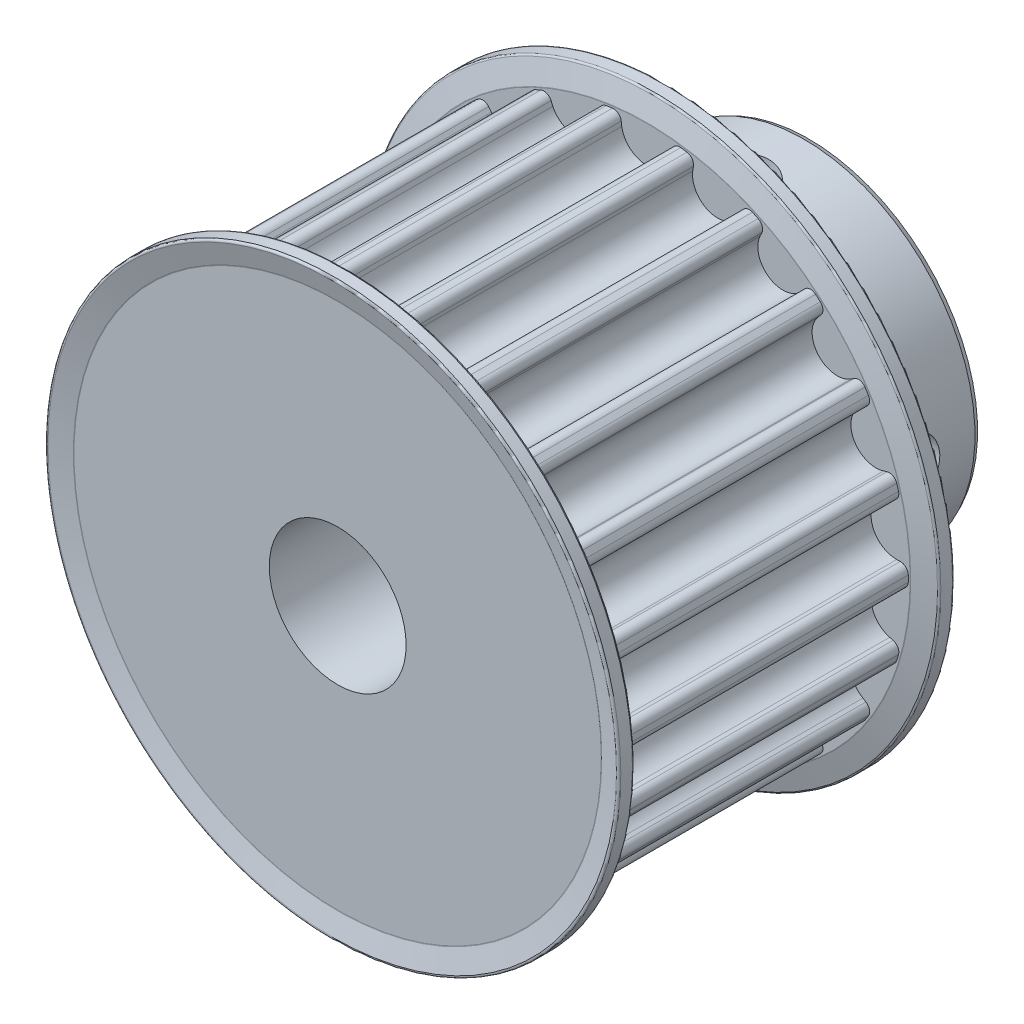
from build123d import *
from OCP.BRepFilletAPI import BRepFilletAPI_MakeChamfer

# Parameters (mm, degrees)
SKETCH4_R                  = 26.776696733
EXTRUDE1_DEPTH             = 15
EXTRUDE2_DEPTH             = 30
CIRPATTERN1_COUNT          = 22
FILLET1_R                  = 0.8
CIRPATTERN2_START          = -15
CIRPATTERN2_DEPTH          = 30
SKETCH12_R                 = 17.5
EXTRUDE4_DEPTH             = 15
F_14_0_14_DIAMETER_HOLE1_D = 14
CHAMFER1_SIZE              = 0.5
CHAMFER1_SIZE2             = 0.233153829
FILLET4_R                  = 0.2
CIRPATTERN3_COUNT          = 2
CIRPATTERN3_ANGLE          = 90


# Read off the part's stored shape, not the designer's step: CirPattern2
with BuildPart() as part:
    # Sketch4 → Extrude1 (new, symmetric)
    with BuildSketch(Plane.XY):
        Circle(SKETCH4_R)
    extrude(amount=EXTRUDE1_DEPTH, both=True)

    # Sketch5 → Extrude2 (cut)
    with BuildSketch(Plane.XY.offset(15)):
        with BuildLine():
            Line((2.550920246, 25.494117302), (2.932220532, 28.605859537))
            Line((2.932220532, 28.605859537), (-2.932220532, 28.605859537))
            Line((-2.932220532, 28.605859537), (-2.538393703, 25.4048791))
            ThreePointArc((-2.538393703, 25.4048791), (0.04505655, 23.237091723), (2.550920246, 25.494117302))
        make_face()
    extrude2 = extrude(amount=-EXTRUDE2_DEPTH, mode=Mode.SUBTRACT)

    # CirPattern1: Extrude2 ×22 about axis
    cirpattern1_axis = Axis((0, 0, 0), (0, 0, 1))
    for i in range(1, CIRPATTERN1_COUNT):
        add(extrude2.rotate(cirpattern1_axis, i * 360 / CIRPATTERN1_COUNT), mode=Mode.SUBTRACT)

    # Fillet1
    fillet1_edges = [part.edges().sort_by_distance(p)[0] for p in [
        (-12.139054278, 23.867024305, 0),
        (-10.087205043, 24.804027543, 0),
    ]]
    fillet(fillet1_edges, radius=FILLET1_R)

    # CirPattern2 outline → CirPattern2 (cut)
    with BuildSketch(Plane.XY.offset(CIRPATTERN2_START)):
        with BuildLine():
            Line((-18.371455068, 19.480275322), (-17.83842324, 18.890459597))
            ThreePointArc((-17.83842324, 18.890459597), (-18.043680061, 19.470813169), (-17.775976802, 20.02513762))
            ThreePointArc((-17.775976802, 20.02513762), (-18.075769041, 19.754950304), (-18.371455068, 19.480275322))
        make_face()
        with BuildLine():
            ThreePointArc((-16.666704462, 20.957396077), (-16.980506715, 20.703958067), (-17.290455681, 20.44582183))
            ThreePointArc((-17.290455681, 20.44582183), (-16.703881608, 20.631899966), (-16.158722414, 20.346425503))
            Line((-16.158722414, 20.346425503), (-16.666704462, 20.957396077))
        make_face()
        with BuildLine():
            Line((-23.115509827, 13.515350287), (-22.437899241, 13.099598663))
            ThreePointArc((-22.437899241, 13.099598663), (-22.798346215, 13.598616308), (-22.697658063, 14.205907447))
            ThreePointArc((-22.697658063, 14.205907447), (-22.909186047, 13.862203382), (-23.115509827, 13.515350287))
        make_face()
        with BuildLine():
            ThreePointArc((-21.895966606, 15.412921019), (-22.125655924, 15.081340719), (-22.350324397, 14.746338098))
            ThreePointArc((-22.350324397, 14.746338098), (-21.839934964, 15.090135775), (-21.236431098, 14.969814127))
            Line((-21.236431098, 14.969814127), (-21.895966606, 15.412921019))
        make_face()
        with BuildLine():
            Line((-25.986883454, 6.45549195), (-25.219590089, 6.247486151))
            ThreePointArc((-25.219590089, 6.247486151), (-25.706025945, 6.624740428), (-25.780510057, 7.235799139))
            ThreePointArc((-25.780510057, 7.235799139), (-25.886637046, 6.846423184), (-25.986883454, 6.45549195))
        make_face()
        with BuildLine():
            ThreePointArc((-25.351347756, 8.619782764), (-25.478316077, 8.236922837), (-25.599502753, 7.852193753))
            ThreePointArc((-25.599502753, 7.852193753), (-25.206646678, 8.325858528), (-24.593690433, 8.38043744))
            Line((-24.593690433, 8.38043744), (-25.351347756, 8.619782764))
        make_face()
        with BuildLine():
            Line((-26.752954333, -1.127351953), (-25.958139735, -1.110760534))
            ThreePointArc((-25.958139735, -1.110760534), (-26.531156333, -0.885832524), (-26.774778448, -0.320510583))
            ThreePointArc((-26.774778448, -0.320510583), (-26.766906665, -0.724013504), (-26.752954333, -1.127351953))
        make_face()
        with BuildLine():
            ThreePointArc((-26.752913481, 1.128320974), (-26.766874587, 0.725198454), (-26.774761643, 0.321911368))
            ThreePointArc((-26.774761643, 0.321911368), (-26.531265786, 0.887069739), (-25.958515233, 1.112127552))
            Line((-25.958515233, 1.112127552), (-26.752913481, 1.128320974))
        make_face()
        with BuildLine():
            Line((-25.351659957, -8.618864505), (-24.593715279, -8.379020006))
            ThreePointArc((-24.593715279, -8.379020006), (-25.206890222, -8.324640592), (-25.599913524, -7.850854443))
            ThreePointArc((-25.599913524, -7.850854443), (-25.478680694, -8.235794923), (-25.351659957, -8.618864505))
        make_face()
        with BuildLine():
            ThreePointArc((-25.987117262, -6.454550672), (-25.886940107, -6.845277195), (-25.78088858, -7.23445036))
            ThreePointArc((-25.78088858, -7.23445036), (-25.706479529, -6.623584165), (-25.22033551, -6.246280297))
            Line((-25.22033551, -6.246280297), (-25.987117262, -6.454550672))
        make_face()
        with BuildLine():
            Line((-21.896524865, -15.412127913), (-21.236854275, -14.96846111))
            ThreePointArc((-21.236854275, -14.96846111), (-21.840511776, -15.089035788), (-22.351095856, -14.745168767))
            ThreePointArc((-22.351095856, -14.745168767), (-22.126323542, -15.080361218), (-21.896524865, -15.412127913))
        make_face()
        with BuildLine():
            ThreePointArc((-23.115999353, -13.514513009), (-22.909799694, -13.861189197), (-22.698401248, -14.204719946))
            ThreePointArc((-22.698401248, -14.204719946), (-22.799107182, -13.597634671), (-22.438954195, -13.098651664))
            Line((-22.438954195, -13.098651664), (-23.115999353, -13.514513009))
        make_face()
        with BuildLine():
            Line((-16.667463551, -20.956792377), (-16.159509638, -20.345246515))
            ThreePointArc((-16.159509638, -20.345246515), (-16.704744956, -20.631007042), (-17.291525329, -20.444917211))
            ThreePointArc((-17.291525329, -20.444917211), (-16.981423247, -20.703206333), (-16.667463551, -20.956792377))
        make_face()
        with BuildLine():
            ThreePointArc((-18.372160653, -19.479609875), (-18.07664356, -19.754150084), (-17.77702444, -20.0242076))
            ThreePointArc((-17.77702444, -20.0242076), (-18.044686763, -19.470085685), (-17.839702261, -18.889848173))
            Line((-17.839702261, -18.889848173), (-18.372160653, -19.479609875))
        make_face()
        with BuildLine():
            Line((-10.088103466, -24.803662157), (-9.773017635, -24.073781045))
            ThreePointArc((-9.773017635, -24.073781045), (-10.215659047, -24.501576804), (-10.831098256, -24.488340052))
            ThreePointArc((-10.831098256, -24.488340052), (-10.460789032, -24.648800798), (-10.088103466, -24.803662157))
        make_face()
        with BuildLine():
            ThreePointArc((-12.13991876, -23.866584599), (-11.779025271, -24.046747215), (-11.415458836, -24.221453043))
            ThreePointArc((-11.415458836, -24.221453043), (-11.828393138, -23.765186149), (-11.795183747, -23.150701526))
            Line((-11.795183747, -23.150701526), (-12.13991876, -23.866584599))
        make_face()
        with BuildLine():
            Line((-2.691465234, -26.641086743), (-2.594773865, -25.852001007))
            ThreePointArc((-2.594773865, -25.852001007), (-2.898961197, -26.387174529), (-3.493200017, -26.547863221))
            ThreePointArc((-3.493200017, -26.547863221), (-3.092683903, -26.597496014), (-2.691465234, -26.641086743))
        make_face()
        with BuildLine():
            ThreePointArc((-4.924172848, -26.32003058), (-4.527140407, -26.391219898), (-4.129080648, -26.456420411))
            ThreePointArc((-4.129080648, -26.456420411), (-4.653833448, -26.134972569), (-4.795089594, -25.536022724))
            Line((-4.795089594, -25.536022724), (-4.924172848, -26.32003058))
        make_face()
        with BuildLine():
            Line((4.923219505, -26.320208921), (4.793683052, -25.535845595))
            ThreePointArc((4.793683052, -25.535845595), (4.652593248, -26.135040303), (4.127696512, -26.456636397))
            ThreePointArc((4.127696512, -26.456636397), (4.525972084, -26.391420285), (4.923219505, -26.320208921))
        make_face()
        with BuildLine():
            ThreePointArc((2.690500262, -26.641184213), (3.091506449, -26.597632899), (3.491811098, -26.548045939))
            ThreePointArc((3.491811098, -26.548045939), (2.897752152, -26.387458942), (2.593474201, -25.85256723))
            Line((2.593474201, -25.85256723), (2.690500262, -26.641184213))
        make_face()
        with BuildLine():
            Line((12.139054278, -23.867024305), (11.793784277, -23.150927841))
            ThreePointArc((11.793784277, -23.150927841), (11.827222259, -23.765600545), (11.414191618, -24.222050236))
            ThreePointArc((11.414191618, -24.222050236), (11.777960728, -24.04726864), (12.139054278, -23.867024305))
        make_face()
        with BuildLine():
            ThreePointArc((10.087205043, -24.804027543), (10.459697838, -24.649263865), (10.829817075, -24.488906673))
            ThreePointArc((10.829817075, -24.488906673), (10.214579105, -24.502190324), (9.771930139, -24.074690489))
            Line((9.771930139, -24.074690489), (10.087205043, -24.804027543))
        make_face()
        with BuildLine():
            Line((18.371455068, -19.480275322), (17.83842324, -18.890459597))
            ThreePointArc((17.83842324, -18.890459597), (18.043680061, -19.470813169), (17.775976802, -20.02513762))
            ThreePointArc((17.775976802, -20.02513762), (18.075769041, -19.754950304), (18.371455068, -19.480275322))
        make_face()
        with BuildLine():
            ThreePointArc((16.666704462, -20.957396077), (16.980506715, -20.703958067), (17.290455681, -20.44582183))
            ThreePointArc((17.290455681, -20.44582183), (16.703881608, -20.631899966), (16.158722414, -20.346425503))
            Line((16.158722414, -20.346425503), (16.666704462, -20.957396077))
        make_face()
        with BuildLine():
            Line((23.115509827, -13.515350287), (22.437899241, -13.099598663))
            ThreePointArc((22.437899241, -13.099598663), (22.798346215, -13.598616308), (22.697658063, -14.205907447))
            ThreePointArc((22.697658063, -14.205907447), (22.909186047, -13.862203382), (23.115509827, -13.515350287))
        make_face()
        with BuildLine():
            ThreePointArc((21.895966606, -15.412921019), (22.125655924, -15.081340719), (22.350324397, -14.746338098))
            ThreePointArc((22.350324397, -14.746338098), (21.839934964, -15.090135775), (21.236431098, -14.969814127))
            Line((21.236431098, -14.969814127), (21.895966606, -15.412921019))
        make_face()
        with BuildLine():
            Line((25.986883454, -6.45549195), (25.219590089, -6.247486151))
            ThreePointArc((25.219590089, -6.247486151), (25.706025945, -6.624740428), (25.780510057, -7.235799139))
            ThreePointArc((25.780510057, -7.235799139), (25.886637046, -6.846423184), (25.986883454, -6.45549195))
        make_face()
        with BuildLine():
            ThreePointArc((25.351347756, -8.619782764), (25.478316077, -8.236922837), (25.599502753, -7.852193753))
            ThreePointArc((25.599502753, -7.852193753), (25.206646678, -8.325858528), (24.593690433, -8.38043744))
            Line((24.593690433, -8.38043744), (25.351347756, -8.619782764))
        make_face()
        with BuildLine():
            Line((26.752954333, 1.127351953), (25.958139735, 1.110760534))
            ThreePointArc((25.958139735, 1.110760534), (26.531156333, 0.885832524), (26.774778448, 0.320510583))
            ThreePointArc((26.774778448, 0.320510583), (26.766906665, 0.724013504), (26.752954333, 1.127351953))
        make_face()
        with BuildLine():
            ThreePointArc((26.752913481, -1.128320974), (26.766874587, -0.725198454), (26.774761643, -0.321911368))
            ThreePointArc((26.774761643, -0.321911368), (26.531265786, -0.887069739), (25.958515233, -1.112127552))
            Line((25.958515233, -1.112127552), (26.752913481, -1.128320974))
        make_face()
        with BuildLine():
            Line((25.351659957, 8.618864505), (24.593715279, 8.379020006))
            ThreePointArc((24.593715279, 8.379020006), (25.206890222, 8.324640592), (25.599913524, 7.850854443))
            ThreePointArc((25.599913524, 7.850854443), (25.478680694, 8.235794923), (25.351659957, 8.618864505))
        make_face()
        with BuildLine():
            ThreePointArc((25.987117262, 6.454550672), (25.886940107, 6.845277195), (25.78088858, 7.23445036))
            ThreePointArc((25.78088858, 7.23445036), (25.706479529, 6.623584165), (25.22033551, 6.246280297))
            Line((25.22033551, 6.246280297), (25.987117262, 6.454550672))
        make_face()
        with BuildLine():
            Line((21.896524865, 15.412127913), (21.236854275, 14.96846111))
            ThreePointArc((21.236854275, 14.96846111), (21.840511776, 15.089035788), (22.351095856, 14.745168767))
            ThreePointArc((22.351095856, 14.745168767), (22.126323542, 15.080361218), (21.896524865, 15.412127913))
        make_face()
        with BuildLine():
            ThreePointArc((23.115999353, 13.514513009), (22.909799694, 13.861189197), (22.698401248, 14.204719946))
            ThreePointArc((22.698401248, 14.204719946), (22.799107182, 13.597634671), (22.438954195, 13.098651664))
            Line((22.438954195, 13.098651664), (23.115999353, 13.514513009))
        make_face()
        with BuildLine():
            Line((16.667463551, 20.956792377), (16.159509638, 20.345246515))
            ThreePointArc((16.159509638, 20.345246515), (16.704744956, 20.631007042), (17.291525329, 20.444917211))
            ThreePointArc((17.291525329, 20.444917211), (16.981423247, 20.703206333), (16.667463551, 20.956792377))
        make_face()
        with BuildLine():
            ThreePointArc((18.372160653, 19.479609875), (18.07664356, 19.754150084), (17.77702444, 20.0242076))
            ThreePointArc((17.77702444, 20.0242076), (18.044686763, 19.470085685), (17.839702261, 18.889848173))
            Line((17.839702261, 18.889848173), (18.372160653, 19.479609875))
        make_face()
        with BuildLine():
            Line((10.088103466, 24.803662157), (9.773017635, 24.073781045))
            ThreePointArc((9.773017635, 24.073781045), (10.215659047, 24.501576804), (10.831098256, 24.488340052))
            ThreePointArc((10.831098256, 24.488340052), (10.460789032, 24.648800798), (10.088103466, 24.803662157))
        make_face()
        with BuildLine():
            ThreePointArc((12.13991876, 23.866584599), (11.779025271, 24.046747215), (11.415458836, 24.221453043))
            ThreePointArc((11.415458836, 24.221453043), (11.828393138, 23.765186149), (11.795183747, 23.150701526))
            Line((11.795183747, 23.150701526), (12.13991876, 23.866584599))
        make_face()
        with BuildLine():
            Line((-4.923219505, 26.320208921), (-4.793683052, 25.535845595))
            ThreePointArc((-4.793683052, 25.535845595), (-4.652593248, 26.135040303), (-4.127696512, 26.456636397))
            ThreePointArc((-4.127696512, 26.456636397), (-4.525972084, 26.391420285), (-4.923219505, 26.320208921))
        make_face()
        with BuildLine():
            ThreePointArc((-2.690500262, 26.641184213), (-3.091506449, 26.597632899), (-3.491811098, 26.548045939))
            ThreePointArc((-3.491811098, 26.548045939), (-2.897752152, 26.387458942), (-2.593474201, 25.85256723))
            Line((-2.593474201, 25.85256723), (-2.690500262, 26.641184213))
        make_face()
        with BuildLine():
            Line((2.691465234, 26.641086743), (2.594773865, 25.852001007))
            ThreePointArc((2.594773865, 25.852001007), (2.898961197, 26.387174529), (3.493200017, 26.547863221))
            ThreePointArc((3.493200017, 26.547863221), (3.092683903, 26.597496014), (2.691465234, 26.641086743))
        make_face()
        with BuildLine():
            ThreePointArc((4.924172848, 26.32003058), (4.527140407, 26.391219898), (4.129080648, 26.456420411))
            ThreePointArc((4.129080648, 26.456420411), (4.653833448, 26.134972569), (4.795089594, 25.536022724))
            Line((4.795089594, 25.536022724), (4.924172848, 26.32003058))
        make_face()
    extrude(amount=CIRPATTERN2_DEPTH, mode=Mode.SUBTRACT)

    # Sketch11 → Revolve2 (revolve)
    with BuildSketch(Plane(origin=(0, 0, 0), x_dir=(1, 0, 0), z_dir=(0, 1, 0))):
        Polygon((-0.006263271, -15), (-0.006263271, -16.6), (-27.006263271, -16.6), (-29.341644753, -17.225763582), (-29.341644753, -15.625763582), (-27.006263271, -15), align=None)
    revolve2 = revolve(axis=Axis((-0.006263271, 0, 15), (0, 0, 1)))

    # Mirror7: Revolve2 across plane
    add(revolve2.mirror(Plane.XY))

    # Sketch12 → Extrude4 (add)
    with BuildSketch(Plane(origin=(0, 0, -16.6), x_dir=(-1, 0, 0), z_dir=(0, 0, -1))):
        Circle(SKETCH12_R)
    extrude(amount=EXTRUDE4_DEPTH)

    # Ø14.0 (14) Diameter Hole1 (through all)
    with Locations(Plane(origin=(0, 0, -31.6), x_dir=(-1, 0, 0), z_dir=(0, 0, -1))):
        with Locations((0, 0)):
            Hole(F_14_0_14_DIAMETER_HOLE1_D / 2)

    # Chamfer1: one chamfer whose edges measure the first distance from different faces: ONE call of the kernel's chamfer builder (chamfer() names one face for all edges)
    chamfer1_edges_1 = [part.edges().sort_by_distance(p)[0] for p in [
        (17.5, 0, -31.6),
    ]]
    chamfer1_side_1 = [part.faces().sort_by_distance(p)[0] for p in [
        (17.5, 0, -24.1),
    ]]
    chamfer1_edges_2 = [part.edges().sort_by_distance(p)[0] for p in [
        (-7, 0, -31.6),
    ]]
    chamfer1_side_2 = [part.faces().sort_by_distance(p)[0] for p in [
        (17.005025253, 0, -31.6),
    ]]
    chamfer1 = BRepFilletAPI_MakeChamfer(part.part.solid().wrapped)
    for e in chamfer1_edges_1:
        chamfer1.Add(CHAMFER1_SIZE, CHAMFER1_SIZE2, e.wrapped, chamfer1_side_1[0].wrapped)  # the first distance lies on this face
    for e in chamfer1_edges_2:
        chamfer1.Add(CHAMFER1_SIZE, CHAMFER1_SIZE2, e.wrapped, chamfer1_side_2[0].wrapped)  # the first distance lies on this face
    add(Compound.cast(chamfer1.Shape()), mode=Mode.REPLACE)

    # Fillet4
    fillet4_edges = [part.edges().sort_by_distance(p)[0] for p in [
        (26.993736729, 0, 15),
        (26.993736729, 0, 16.6),
        (29.32911821, 0, 17.225763582),
        (29.32911821, 0, 15.625763582),
        (26.993736729, 0, -16.6),
        (29.32911821, 0, -17.225763582),
        (29.32911821, 0, -15.625763582),
        (26.993736729, 0, -15),
        (17.5, 0, -16.6),
    ]]
    fillet(fillet4_edges, radius=FILLET4_R)

    # Sketch17 → M8 Tapped Hole1 (revolve, cut)
    with BuildSketch(Plane(origin=(18, 0, -24.1), x_dir=(0, 0, -1), z_dir=(0, 1, 0))):
        Polygon((0, 0), (0, 16.192926105), (3.4, 14.15), (3.4, 0), align=None)
    m8_tapped_hole1 = revolve(axis=Axis((24.35, 0, -24.1), (-1, 0, 0)), mode=Mode.SUBTRACT)

    # CirPattern3: M8 Tapped Hole1 ×2 about axis
    cirpattern3_axis = Axis((0, 0, -31.6), (0, 0, 1))
    for i in range(1, CIRPATTERN3_COUNT):
        add(m8_tapped_hole1.rotate(cirpattern3_axis, i * CIRPATTERN3_ANGLE / (CIRPATTERN3_COUNT - 1)), mode=Mode.SUBTRACT)


solid = part.part
